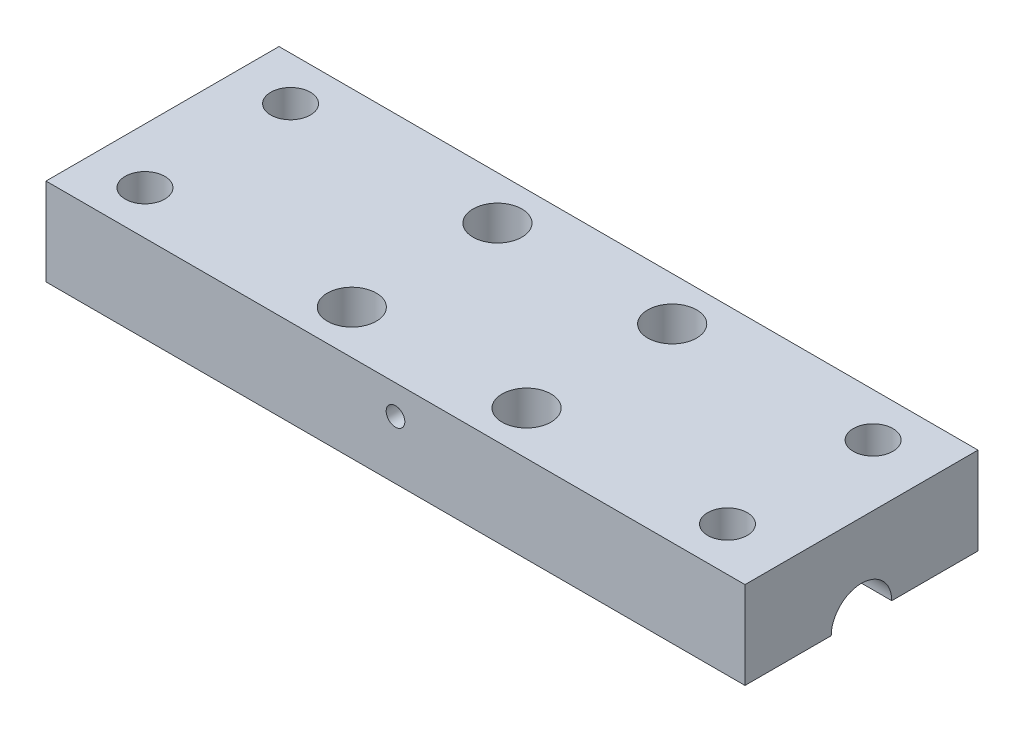
from build123d import *

# Parameters (mm, degrees)
SKETCH1_W           = 76.2
SKETCH1_H           = 25.4
BOSS_EXTRUDE1_DEPTH = 9.525
SKETCH2_R           = 2.159
CUT_EXTRUDE1_DEPTH  = 42.275
SKETCH3_R           = 2.667
CUT_EXTRUDE2_DEPTH  = 42.275
SKETCH4_R           = 1.016
CUT_EXTRUDE3_DEPTH  = 7.62
CUT_EXTRUDE4_START  = -7.62
SKETCH5_R           = 1.016
CUT_EXTRUDE4_DEPTH  = 7.62
SKETCH7_R           = 3.302
CUT_EXTRUDE5_DEPTH  = 78.836081768


with BuildPart() as part:
    # Sketch1 → Boss-Extrude1 (new body)
    with BuildSketch(Plane(origin=(0, 0, 0), x_dir=(1, 0, 0), z_dir=(0, 1, 0))):
        Rectangle(SKETCH1_W, SKETCH1_H)
    extrude(amount=BOSS_EXTRUDE1_DEPTH)

    # Sketch2 → Cut-Extrude1 (cut, through all)
    with BuildSketch(Plane(origin=(0, 9.525, 0), x_dir=(1, 0, 0), z_dir=(0, 1, 0))):
        with Locations((-32.074075882, 7.9375)):
            Circle(SKETCH2_R)
        with Locations((-32.074075882, -7.9375)):
            Circle(SKETCH2_R)
        with Locations((31.425924118, 7.9375)):
            Circle(SKETCH2_R)
        with Locations((31.425924118, -7.9375)):
            Circle(SKETCH2_R)
    extrude(amount=-CUT_EXTRUDE1_DEPTH, mode=Mode.SUBTRACT)

    # Sketch3 → Cut-Extrude2 (cut, through all)
    with BuildSketch(Plane(origin=(0, 9.525, 0), x_dir=(1, 0, 0), z_dir=(0, 1, 0))):
        with Locations((-9.525, 7.9375)):
            Circle(SKETCH3_R)
        with Locations((-9.525, -7.9375)):
            Circle(SKETCH3_R)
        with Locations((9.525, 7.9375)):
            Circle(SKETCH3_R)
        with Locations((9.525, -7.9375)):
            Circle(SKETCH3_R)
    extrude(amount=-CUT_EXTRUDE2_DEPTH, mode=Mode.SUBTRACT)

    # Sketch4 → Cut-Extrude3 (cut)
    with BuildSketch(Plane.XY.offset(12.7)):
        with Locations((0, 6.35)):
            Circle(SKETCH4_R)
    extrude(amount=-CUT_EXTRUDE3_DEPTH, mode=Mode.SUBTRACT)

    # Sketch5 → Cut-Extrude4 (cut)
    with BuildSketch(Plane(origin=(0, 0, -12.7), x_dir=(-1, 0, 0), z_dir=(0, 0, -1)).offset(CUT_EXTRUDE4_START)):
        with Locations((0, 6.35)):
            Circle(SKETCH5_R)
    extrude(amount=CUT_EXTRUDE4_DEPTH, mode=Mode.SUBTRACT)

    # Sketch7 → Cut-Extrude5 (cut, through all)
    with BuildSketch(Plane(origin=(38.1, 0, 0), x_dir=(0, 0, -1), z_dir=(1, 0, 0))):
        Circle(SKETCH7_R)
    extrude(amount=-CUT_EXTRUDE5_DEPTH, mode=Mode.SUBTRACT)


solid = part.part
